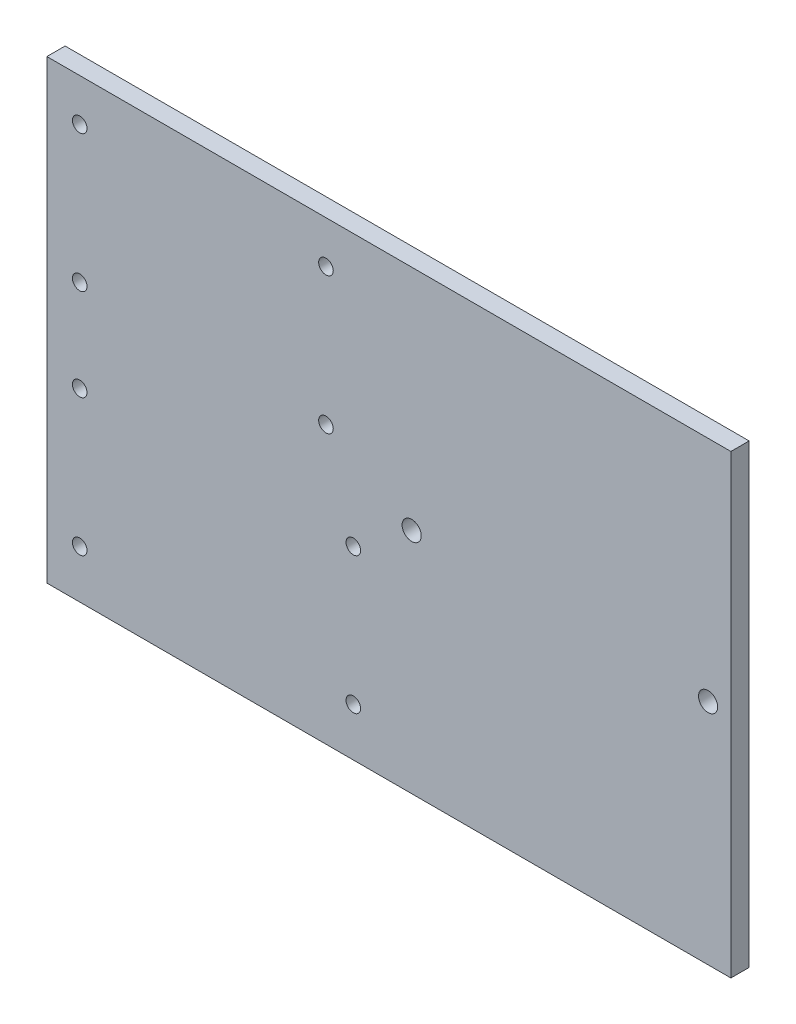
from build123d import *

# Parameters (mm, degrees)
SKETCH_1_W      = 150
SKETCH_1_H      = 100
SKETCH_1_R      = 2.1
SKETCH_1_R_2    = 1.6
EXTRUDE_1_DEPTH = 4


with BuildPart() as part:
    # 草图1 → 凸台-拉伸1 (new body)
    with BuildSketch(Plane.XY):
        with Locations((22.02970297, -3.589108911)):
            Rectangle(SKETCH_1_W, SKETCH_1_H)
        with Locations((92.02970297, -3.589108911)):
            Circle(SKETCH_1_R, mode=Mode.SUBTRACT)
        with Locations((27.02970297, -3.589108911)):
            Circle(SKETCH_1_R, mode=Mode.SUBTRACT)
        with Locations((-45.767283025, -43.020903704)):
            Circle(SKETCH_1_R_2, mode=Mode.SUBTRACT)
        with Locations((-45.767283025, -13.020903704)):
            Circle(SKETCH_1_R_2, mode=Mode.SUBTRACT)
        with Locations((14.232716975, -13.020903704)):
            Circle(SKETCH_1_R_2, mode=Mode.SUBTRACT)
        with Locations((14.232716975, -43.020903704)):
            Circle(SKETCH_1_R_2, mode=Mode.SUBTRACT)
        with Locations((-45.767283025, 37.129067293)):
            Circle(SKETCH_1_R_2, mode=Mode.SUBTRACT)
        with Locations((-45.767283025, 7.129067293)):
            Circle(SKETCH_1_R_2, mode=Mode.SUBTRACT)
        with Locations((8.232716975, 7.129067293)):
            Circle(SKETCH_1_R_2, mode=Mode.SUBTRACT)
        with Locations((8.232716975, 37.129067293)):
            Circle(SKETCH_1_R_2, mode=Mode.SUBTRACT)
    extrude(amount=EXTRUDE_1_DEPTH)


solid = part.part
